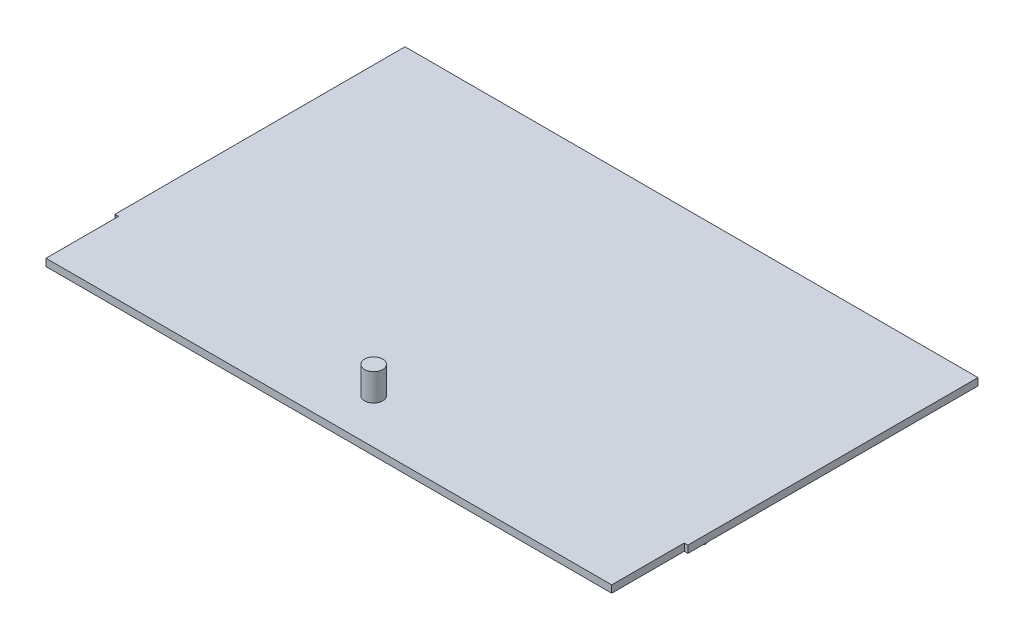
from build123d import *

# Parameters (mm, degrees)
BOSS_EXTRUDE1_DEPTH = 2
SKETCH2_R           = 2.5
BOSS_EXTRUDE2_DEPTH = 7.5


with BuildPart() as part:
    # Sketch1 → Boss-Extrude1 (new body)
    with BuildSketch(Plane(origin=(0, 0, 0), x_dir=(1, 0, 0), z_dir=(0, 1, 0))):
        Polygon((-5.476041667, 107.710069444), (-5.476041667, 27.710069444), (-4.476041667, 27.710069444), (-4.476041667, 7.710069444), (151.523958333, 7.710069444), (151.523958333, 27.710069444), (152.523958333, 27.710069444), (152.523958333, 107.710069444), align=None)
    extrude(amount=BOSS_EXTRUDE1_DEPTH)

    # Sketch2 → Boss-Extrude2 (add)
    with BuildSketch(Plane(origin=(0, 2, 0), x_dir=(1, 0, 0), z_dir=(0, 1, 0))):
        with Locations((73.523958333, 20.058282781)):
            Circle(SKETCH2_R)
    extrude(amount=BOSS_EXTRUDE2_DEPTH)

    # Sketch4 → Revolve3 (revolve)
    with BuildSketch(Plane.XZ):
        with BuildLine():
            Line((-5.476041667, -31.033716533), (-4.476041667, -31.033716533))
            ThreePointArc((-4.476041667, -31.033716533), (-4.976041667, -30.533716533), (-5.476041667, -31.033716533))
        make_face()
    revolve(axis=Axis((-5.476041667, 0, -31.033716533), (1, 0, 0)))

    # Sketch7 → Revolve4 (revolve)
    with BuildSketch(Plane.XZ):
        with BuildLine():
            Line((152.023958333, -32.710069444), (152.048698634, -32.210681902))
            ThreePointArc((152.048698634, -32.210681902), (151.524570791, -32.685329143), (151.999218032, -33.209456987))
            Line((151.999218032, -33.209456987), (152.023958333, -32.710069444))
        make_face()
    revolve(axis=Axis((152.023958333, 0, -32.710069444), (-0.04948060224907448, 0, -0.998775084791901)))


solid = part.part
